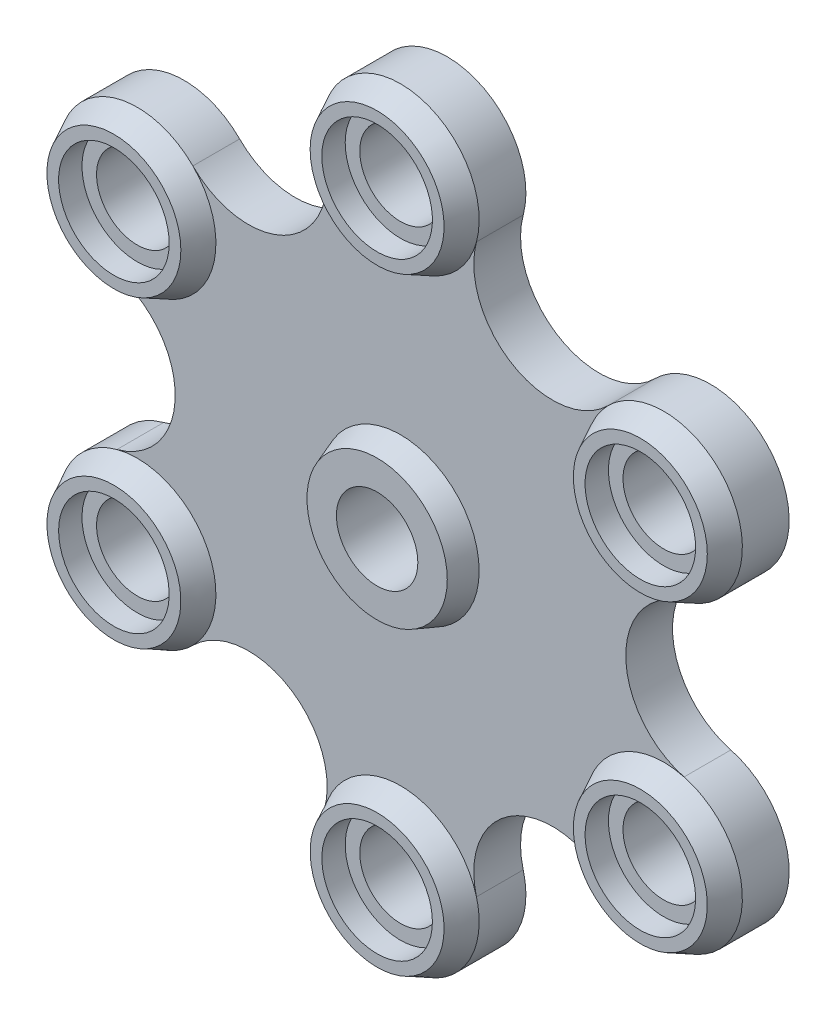
from build123d import *

# Parameters (mm, degrees)
SKETCH2_R           = 17.416697508
BOSS_EXTRUDE1_DEPTH = 20
SKETCH7_R           = 17.416697508
CUT_EXTRUDE2_DEPTH  = 20
CIRPATTERN1_COUNT   = 6
SKETCH8_R           = 33.646475863
BOSS_EXTRUDE2_DEPTH = 30
SKETCH10_R          = 17.416697508
CUT_EXTRUDE3_DEPTH  = 30
CHAMFER1_SIZE2      = 3.639702343
CHAMFER1_SIZE       = 10


with BuildPart() as part:
    # Sketch2 → Boss-Extrude1 (new body)
    with BuildSketch(Plane.XY):
        with BuildLine():
            ThreePointArc((32.5, 121.291651246), (0, 163.646475863), (-32.5, 121.291651246))
            ThreePointArc((-32.5, 121.291651246), (-48.176762068, 83.444599647), (-88.791651246, 88.791651246))
            ThreePointArc((-88.791651246, 88.791651246), (-141.722005337, 81.823237932), (-121.291651246, 32.5))
            ThreePointArc((-121.291651246, 32.5), (-96.353524137, 0), (-121.291651246, -32.5))
            ThreePointArc((-121.291651246, -32.5), (-141.722005337, -81.823237932), (-88.791651246, -88.791651246))
            ThreePointArc((-88.791651246, -88.791651246), (-48.176762068, -83.444599647), (-32.5, -121.291651246))
            ThreePointArc((-32.5, -121.291651246), (0, -163.646475863), (32.5, -121.291651246))
            ThreePointArc((32.5, -121.291651246), (48.176762068, -83.444599647), (88.791651246, -88.791651246))
            ThreePointArc((88.791651246, -88.791651246), (141.722005337, -81.823237932), (121.291651246, -32.5))
            ThreePointArc((121.291651246, -32.5), (96.353524137, 0), (121.291651246, 32.5))
            ThreePointArc((121.291651246, 32.5), (141.722005337, 81.823237932), (88.791651246, 88.791651246))
            ThreePointArc((88.791651246, 88.791651246), (48.176762068, 83.444599647), (32.5, 121.291651246))
        make_face()
        with Locations((0, 130)):
            Circle(SKETCH2_R, mode=Mode.SUBTRACT)
        with Locations((112.583302492, 65)):
            Circle(SKETCH2_R, mode=Mode.SUBTRACT)
        with Locations((112.583302492, -65)):
            Circle(SKETCH2_R, mode=Mode.SUBTRACT)
        with Locations((0, -130)):
            Circle(SKETCH2_R, mode=Mode.SUBTRACT)
        with Locations((-112.583302492, -65)):
            Circle(SKETCH2_R, mode=Mode.SUBTRACT)
        with Locations((-112.583302492, 65)):
            Circle(SKETCH2_R, mode=Mode.SUBTRACT)
    extrude(amount=BOSS_EXTRUDE1_DEPTH)

    # Sketch4 → Revolve1 (revolve)
    with BuildSketch(Plane(origin=(0, 0, 0), x_dir=(0, 0, -1), z_dir=(1, 0, 0)), mode=Mode.PRIVATE) as revolve1_sk:
        Polygon((-20, 163.646475863), (-30, 158.646475863), (-30, 153.646475863), (-20, 153.646475863), align=None)
    revolve1 = revolve(revolve1_sk.sketch.rotate(Axis((0, 130, 0), (0, 0, 1)), 90), axis=Axis((0, 130, 0), (0, 0, 1)))

    # Sketch7 → Cut-Extrude2 (cut)
    with BuildSketch(Plane.XY):
        Circle(SKETCH7_R)
    extrude(amount=CUT_EXTRUDE2_DEPTH, mode=Mode.SUBTRACT)

    # CirPattern1: Revolve1 ×6 about axis
    cirpattern1_axis = Axis((0, 0, 0), (0, 0, 1))
    for i in range(1, CIRPATTERN1_COUNT):
        add(revolve1.rotate(cirpattern1_axis, i * 360 / CIRPATTERN1_COUNT))

    # Sketch8 → Boss-Extrude2 (add)
    with BuildSketch(Plane.XY):
        Circle(SKETCH8_R)
    extrude(amount=BOSS_EXTRUDE2_DEPTH)

    # Sketch10 → Cut-Extrude3 (cut)
    with BuildSketch(Plane.XY):
        Circle(SKETCH10_R)
    extrude(amount=CUT_EXTRUDE3_DEPTH, mode=Mode.SUBTRACT)

    # Chamfer1
    chamfer1_edges = [part.edges().sort_by_distance(p)[0] for p in [
        (-33.646475863, 0, 30),
    ]]
    chamfer1_side = [part.faces().sort_by_distance(p)[0] for p in [
        (-33.646475863, 0, 29.927205953),
    ]]
    chamfer(chamfer1_edges, length=CHAMFER1_SIZE - 0.0001, length2=CHAMFER1_SIZE2 - 0.0001, reference=chamfer1_side[0])  # a hair under: the kernel refuses the full size


solid = part.part
